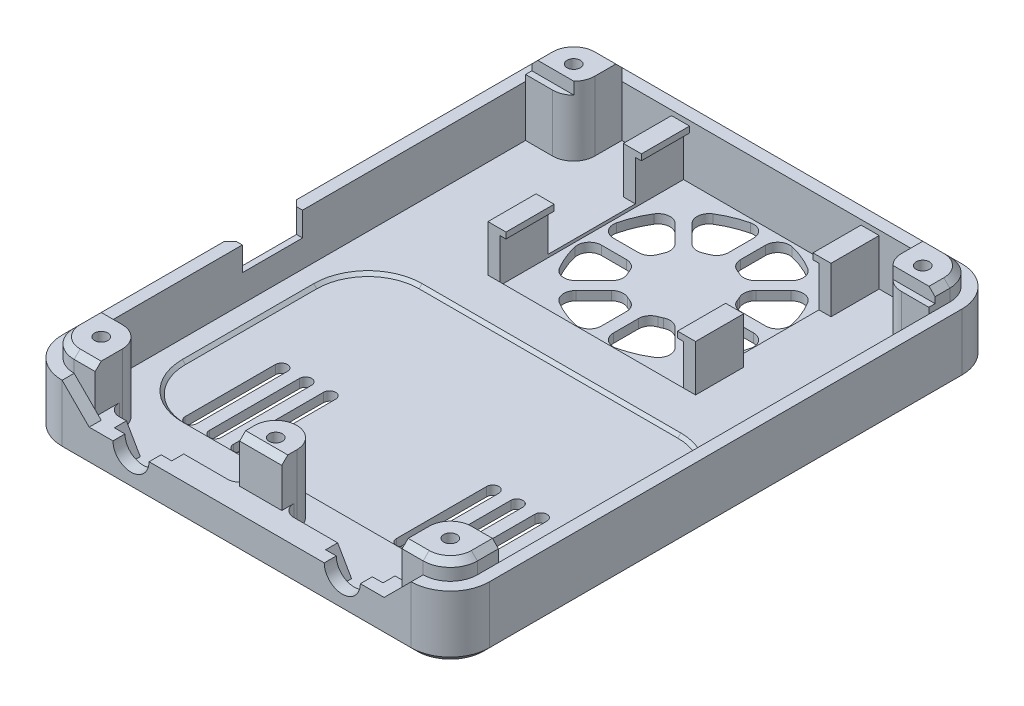
from build123d import *

# Parameters (mm, degrees)
BOSS_EXTRUDE1_DEPTH            = 10.5
BOSS_EXTRUDE2_DEPTH            = 2
BOSS_EXTRUDE4_DEPTH            = 11.5
BOSS_EXTRUDE6_REACH            = 65.208
CUT_EXTRUDE1_DEPTH             = 2
CUT_EXTRUDE2_REACH             = 89.912
SKETCH9_W                      = 10
SKETCH9_H                      = 4
CHAMFER1_SIZE                  = 1
CHAMFER2_SIZE                  = 1
BOSS_EXTRUDE7_DEPTH            = 2
SKETCH21_W                     = 67
SKETCH21_H                     = 1.043656047
CUT_EXTRUDE4_DEPTH             = 2
CUT_EXTRUDE5_DEPTH             = 0.5
CHAMFER4_SIZE                  = 1.5
CHAMFER5_SIZE                  = 1
CHAMFER6_SIZE                  = 1
CHAMFER7_SIZE                  = 1
F_2_2_2_2_DIAMETER_HOLE1_D     = 2.2
F_2_2_2_2_DIAMETER_HOLE1_DEPTH = 11.5
F_2_2_2_2_DIAMETER_HOLE1_TIP   = 0.660946681
SKETCH27_W                     = 7
SKETCH27_H                     = 2
CUT_EXTRUDE6_DEPTH             = 7.5
FILLET1_R                      = 2
CHAMFER8_SIZE                  = 1
CUT_EXTRUDE7_DEPTH             = 64.601942107
SKETCH29_W                     = 30.5
SKETCH29_H                     = 30.5
CUT_EXTRUDE8_DEPTH             = 0.5
SKETCH30_W                     = 2
SKETCH30_H                     = 8
BOSS_EXTRUDE8_DEPTH            = 7.7
SKETCH32_W                     = 1
SKETCH32_H                     = 8
BOSS_EXTRUDE10_DEPTH           = 1
CUT_EXTRUDE9_REACH             = 65.301


with BuildPart() as part:
    # Sketch2 → Boss-Extrude1 (new body)
    with BuildSketch(Plane(origin=(0, 0, 0), x_dir=(1, 0, 0), z_dir=(0, 1, 0))):
        with BuildLine():
            Line((-30.346153846, 41.446848386), (27.653846154, 41.446848386))
            ThreePointArc((27.653846154, 41.446848386), (32.250040232, 39.543042463), (34.153846154, 34.946848386))
            Line((34.153846154, 34.946848386), (34.153846154, -43.553151614))
            ThreePointArc((34.153846154, -43.553151614), (32.250040232, -48.149345692), (27.653846154, -50.053151614))
            Line((27.653846154, -50.053151614), (-30.346153846, -50.053151614))
            ThreePointArc((-30.346153846, -50.053151614), (-34.942347924, -48.149345692), (-36.846153846, -43.553151614))
            Line((-36.846153846, -43.553151614), (-36.846153846, 34.946848386))
            ThreePointArc((-36.846153846, 34.946848386), (-34.942347924, 39.543042463), (-30.346153846, 41.446848386))
        make_face()
        with BuildLine():
            Line((-30.346153846, 39.446848386), (27.653846154, 39.446848386))
            ThreePointArc((27.653846154, 39.446848386), (30.835826669, 38.128828901), (32.153846154, 34.946848386))
            Line((32.153846154, 34.946848386), (32.153846154, -43.553151614))
            ThreePointArc((32.153846154, -43.553151614), (30.835826669, -46.73513213), (27.653846154, -48.053151614))
            Line((27.653846154, -48.053151614), (-30.346153846, -48.053151614))
            ThreePointArc((-30.346153846, -48.053151614), (-33.528134361, -46.73513213), (-34.846153846, -43.553151614))
            Line((-34.846153846, -43.553151614), (-34.846153846, 34.946848386))
            ThreePointArc((-34.846153846, 34.946848386), (-33.528134361, 38.128828901), (-30.346153846, 39.446848386))
        make_face(mode=Mode.SUBTRACT)
    extrude(amount=BOSS_EXTRUDE1_DEPTH)

    # Sketch3 → Boss-Extrude2 (add)
    with BuildSketch(Plane(origin=(0, 0, 0), x_dir=(1, 0, 0), z_dir=(0, 1, 0))):
        with BuildLine():
            Line((-30.346153846, -48.053151614), (27.653846154, -48.053151614))
            ThreePointArc((27.653846154, -48.053151614), (30.835826669, -46.73513213), (32.153846154, -43.553151614))
            Line((32.153846154, -43.553151614), (32.153846154, 34.946848386))
            ThreePointArc((32.153846154, 34.946848386), (30.835826669, 38.128828901), (27.653846154, 39.446848386))
            Line((27.653846154, 39.446848386), (-30.346153846, 39.446848386))
            ThreePointArc((-30.346153846, 39.446848386), (-33.528134361, 38.128828901), (-34.846153846, 34.946848386))
            Line((-34.846153846, 34.946848386), (-34.846153846, -43.553151614))
            ThreePointArc((-34.846153846, -43.553151614), (-33.528134361, -46.73513213), (-30.346153846, -48.053151614))
        make_face()
    extrude(amount=BOSS_EXTRUDE2_DEPTH)

    # Sketch6 → Boss-Extrude4 (add)
    with BuildSketch(Plane(origin=(0, 2, 0), x_dir=(1, 0, 0), z_dir=(0, 1, 0))):
        with BuildLine():
            Line((-26.846153846, 34.946848386), (-26.846153846, 39.446848386))
            Line((-26.846153846, 39.446848386), (-30.346153846, 39.446848386))
            ThreePointArc((-30.346153846, 39.446848386), (-33.528134361, 38.128828901), (-34.846153846, 34.946848386))
            Line((-34.846153846, 34.946848386), (-34.846153846, 31.446848386))
            Line((-34.846153846, 31.446848386), (-30.346153846, 31.446848386))
            ThreePointArc((-30.346153846, 31.446848386), (-27.871280112, 32.471974652), (-26.846153846, 34.946848386))
        make_face()
        with BuildLine():
            Line((24.153846154, 34.946848386), (24.153846154, 39.446848386))
            Line((24.153846154, 39.446848386), (27.653846154, 39.446848386))
            ThreePointArc((27.653846154, 39.446848386), (30.835826669, 38.128828901), (32.153846154, 34.946848386))
            Line((32.153846154, 34.946848386), (32.153846154, 31.446848386))
            Line((32.153846154, 31.446848386), (27.653846154, 31.446848386))
            ThreePointArc((27.653846154, 31.446848386), (25.17897242, 32.471974652), (24.153846154, 34.946848386))
        make_face()
    extrude(amount=BOSS_EXTRUDE4_DEPTH)

    # Boss-Extrude6: up to this face of the body (flat: up to its plane)
    boss_extrude6_end = Plane(part.part.faces().sort_by_distance((-30.766287969, 13.5, -35.366982508))[0])
    # Sketch8 → Boss-Extrude6 (add, up to the picked face)
    with BuildSketch(Plane(origin=(0, 2, 0), x_dir=(1, 0, 0), z_dir=(0, 1, 0)), mode=Mode.PRIVATE) as boss_extrude6_sk1:
        with BuildLine():
            Line((-4.846153846, -43.553151614), (-4.846153846, -48.053151614))
            Line((-4.846153846, -48.053151614), (2.153846154, -48.053151614))
            Line((2.153846154, -48.053151614), (2.153846154, -43.553151614))
            ThreePointArc((2.153846154, -43.553151614), (-1.346153846, -40.053151614), (-4.846153846, -43.553151614))
        make_face()
    boss_extrude6_tool1 = split(extrude(boss_extrude6_sk1.sketch, amount=BOSS_EXTRUDE6_REACH, mode=Mode.PRIVATE), bisect_by=boss_extrude6_end, keep=Keep.BOTH, mode=Mode.PRIVATE)
    # Sketch8 → Boss-Extrude6 (add, up to the picked face)
    with BuildSketch(Plane(origin=(0, 2, 0), x_dir=(1, 0, 0), z_dir=(0, 1, 0)), mode=Mode.PRIVATE) as boss_extrude6_sk2:
        with BuildLine():
            Line((32.153846154, -40.053151614), (32.153846154, -43.553151614))
            ThreePointArc((32.153846154, -43.553151614), (30.835826669, -46.73513213), (27.653846154, -48.053151614))
            Line((27.653846154, -48.053151614), (24.153846154, -48.053151614))
            Line((24.153846154, -48.053151614), (24.153846154, -43.553151614))
            ThreePointArc((24.153846154, -43.553151614), (25.17897242, -41.07827788), (27.653846154, -40.053151614))
            Line((27.653846154, -40.053151614), (32.153846154, -40.053151614))
        make_face()
    boss_extrude6_tool2 = split(extrude(boss_extrude6_sk2.sketch, amount=BOSS_EXTRUDE6_REACH, mode=Mode.PRIVATE), bisect_by=boss_extrude6_end, keep=Keep.BOTH, mode=Mode.PRIVATE)
    # Sketch8 → Boss-Extrude6 (add, up to the picked face)
    with BuildSketch(Plane(origin=(0, 2, 0), x_dir=(1, 0, 0), z_dir=(0, 1, 0)), mode=Mode.PRIVATE) as boss_extrude6_sk3:
        with BuildLine():
            Line((-34.846153846, -40.053151614), (-34.846153846, -43.553151614))
            ThreePointArc((-34.846153846, -43.553151614), (-33.528134361, -46.73513213), (-30.346153846, -48.053151614))
            Line((-30.346153846, -48.053151614), (-26.846153846, -48.053151614))
            Line((-26.846153846, -48.053151614), (-26.846153846, -43.553151614))
            ThreePointArc((-26.846153846, -43.553151614), (-27.871280112, -41.07827788), (-30.346153846, -40.053151614))
            Line((-30.346153846, -40.053151614), (-34.846153846, -40.053151614))
        make_face()
    boss_extrude6_tool3 = split(extrude(boss_extrude6_sk3.sketch, amount=BOSS_EXTRUDE6_REACH, mode=Mode.PRIVATE), bisect_by=boss_extrude6_end, keep=Keep.BOTH, mode=Mode.PRIVATE)
    add(boss_extrude6_tool1.solids().sort_by(Axis((-1.346154, 2, 44.386612), (0, 1, 0)))[0])
    add(boss_extrude6_tool2.solids().sort_by(Axis((28.07398, 2, 43.973286), (0, 1, 0)))[0])
    add(boss_extrude6_tool3.solids().sort_by(Axis((-30.766288, 2, 43.973286), (0, 1, 0)))[0])

    # Sketch7 → Cut-Extrude1 (cut)
    with BuildSketch(Plane.XY.offset(50.053151614)):
        with BuildLine():
            Line((27.653846154, 10.5), (-30.346153846, 10.5))
            Line((-30.346153846, 10.5), (-25.846153846, 6))
            Line((-25.846153846, 6), (-21.89693017, 6))
            ThreePointArc((-21.89693017, 6), (-18.89693017, 3), (-15.89693017, 6))
            Line((-15.89693017, 6), (13.204622477, 6))
            ThreePointArc((13.204622477, 6), (16.204622477, 3), (19.204622477, 6))
            Line((19.204622477, 6), (23.153846154, 6))
            Line((23.153846154, 6), (27.653846154, 10.5))
        make_face()
    extrude(amount=-CUT_EXTRUDE1_DEPTH, mode=Mode.SUBTRACT)

    # Sketch9 → Cut-Extrude2 (cut, up to next)
    with BuildSketch(Plane.ZY.offset(36.846153846), mode=Mode.PRIVATE) as cut_extrude2_sk1:
        with Locations((10.611298715, 8.5)):
            Rectangle(SKETCH9_W, SKETCH9_H)
    cut_extrude2_tool1 = extrude(cut_extrude2_sk1.sketch, amount=-CUT_EXTRUDE2_REACH, mode=Mode.PRIVATE) & part.part
    add(cut_extrude2_tool1.solids().sort_by_distance((-36.846154, 8.5, 10.611299))[0], mode=Mode.SUBTRACT)

    # Chamfer1
    chamfer1_edges = [part.edges().sort_by_distance(p)[0] for p in [
        (-36.846153846, 8.5, 5.611298715),
        (-36.846153846, 6.5, 10.611298715),
        (-36.846153846, 8.5, 15.611298715),
    ]]
    chamfer(chamfer1_edges, length=CHAMFER1_SIZE)

    # Chamfer2
    chamfer2_edges = [part.edges().sort_by_distance(p)[0] for p in [
        (-36.846153846, 0, 4.303151614),
        (-34.942347924, 0, -39.543042463),
        (-1.346153846, 0, -41.446848386),
        (32.250040232, 0, -39.543042463),
        (34.153846154, 0, 4.303151614),
        (32.250040232, 0, 48.149345692),
        (-1.346153846, 0, 50.053151614),
        (-34.942347924, 0, 48.149345692),
    ]]
    chamfer(chamfer2_edges, length=CHAMFER2_SIZE)

    # Sketch19 → Boss-Extrude7 (add)
    with BuildSketch(Plane(origin=(0, 0, 48.053151614), x_dir=(-1, 0, 0), z_dir=(0, 0, -1))):
        Polygon((26.846153846, 6), (23.660734993, 6), (21.351333916, 2), (26.846153846, 2), align=None)
        Polygon((4.846153846, 2), (16.442526423, 2), (14.133125347, 6), (4.846153846, 6), align=None)
        Polygon((-13.750218731, 2), (-2.153846154, 2), (-2.153846154, 6), (-11.440817654, 6), align=None)
        Polygon((-24.153846154, 2), (-18.659026224, 2), (-20.968427301, 6), (-24.153846154, 6), align=None)
    extrude(amount=BOSS_EXTRUDE7_DEPTH)

    # Sketch21 → Cut-Extrude4 (cut)
    with BuildSketch(Plane(origin=(0, 13.5, 0), x_dir=(1, 0, 0), z_dir=(0, 1, 0))):
        with Locations((-1.346153846, 31.96867641)):
            Rectangle(SKETCH21_W, SKETCH21_H)
    extrude(amount=-CUT_EXTRUDE4_DEPTH, mode=Mode.SUBTRACT)

    # Sketch22 → Cut-Extrude5 (cut)
    with BuildSketch(Plane(origin=(0, 2, 0), x_dir=(1, 0, 0), z_dir=(0, 1, 0))):
        with BuildLine():
            Line((-22.846153846, 3.259423313), (20.153846154, 3.259423313))
            ThreePointArc((20.153846154, 3.259423313), (27.224913966, 0.330491125), (30.153846154, -6.740576687))
            Line((30.153846154, -6.740576687), (30.153846154, -28.568151594))
            ThreePointArc((30.153846154, -28.568151594), (27.224913966, -35.639219406), (20.153846154, -38.568151594))
            Line((20.153846154, -38.568151594), (-22.846153846, -38.568151594))
            ThreePointArc((-22.846153846, -38.568151594), (-29.917221658, -35.639219406), (-32.846153846, -28.568151594))
            Line((-32.846153846, -28.568151594), (-32.846153846, -6.740576687))
            ThreePointArc((-32.846153846, -6.740576687), (-29.917221658, 0.330491125), (-22.846153846, 3.259423313))
        make_face()
    extrude(amount=-CUT_EXTRUDE5_DEPTH, mode=Mode.SUBTRACT)

    # Chamfer4
    # the kernel refuses this chamfer: 1.5 mm, written as the material it adds along each edge
    with BuildSketch(Plane(origin=(20.153846154, 1.5, 38.568151594), x_dir=(0, 0.9996219169112968, 0.027495876610586775), z_dir=(-1, 0, 0))) as chamfer4_piece_1_section:
        Polygon((CHAMFER4_SIZE * 0.999621916911, CHAMFER4_SIZE * 0.0274958766106), (-CHAMFER4_SIZE * 0.0274958766106, CHAMFER4_SIZE * 0.999621916911), (0, 0), align=None)
    chamfer4_piece_1 = extrude(amount=43, mode=Mode.PRIVATE)
    chamfer4_piece_1 = split(chamfer4_piece_1, bisect_by=Plane(origin=(-1.346153846, 2, 37.925091261), z_dir=(0, -1, 0)), keep=Keep.TOP, mode=Mode.PRIVATE)
    add(chamfer4_piece_1)
    with BuildSketch(Plane(origin=(20.153846154, 1.5, 28.568151594), x_dir=(1, 0, 0), z_dir=(0, 0, -1))) as chamfer4_piece_2_section:
        Polygon((10, -CHAMFER4_SIZE), (10 - CHAMFER4_SIZE, 0), (10, 0), align=None)
    chamfer4_piece_2 = revolve(axis=Axis((20.153846154, 1.5, 28.568151594), (0, -1, 0)), revolution_arc=90, mode=Mode.PRIVATE)
    chamfer4_piece_2 = split(chamfer4_piece_2, bisect_by=Plane(origin=(26.336878158, 2, 34.751183598), z_dir=(0, -1, 0)), keep=Keep.TOP, mode=Mode.PRIVATE)
    add(chamfer4_piece_2)
    with BuildSketch(Plane(origin=(-22.846153846, 1.5, 28.568151594), x_dir=(0, 0, 1), z_dir=(1, 0, 0))) as chamfer4_piece_3_section:
        Polygon((10, -CHAMFER4_SIZE), (10 - CHAMFER4_SIZE, 0), (10, 0), align=None)
    chamfer4_piece_3 = revolve(axis=Axis((-22.846153846, 1.5, 28.568151594), (0, -1, 0)), revolution_arc=90, mode=Mode.PRIVATE)
    chamfer4_piece_3 = split(chamfer4_piece_3, bisect_by=Plane(origin=(-29.02918585, 2, 34.751183598), z_dir=(0, -1, 0)), keep=Keep.TOP, mode=Mode.PRIVATE)
    add(chamfer4_piece_3)
    with BuildSketch(Plane(origin=(30.153846154, 1.5, 6.740576687), x_dir=(0.027495876610586775, 0.9996219169112968, 0), z_dir=(0, 0, 1))) as chamfer4_piece_4_section:
        Polygon((CHAMFER4_SIZE * 0.999621916911, CHAMFER4_SIZE * 0.0274958766106), (-CHAMFER4_SIZE * 0.0274958766106, CHAMFER4_SIZE * 0.999621916911), (0, 0), align=None)
    chamfer4_piece_4 = extrude(amount=21.827574907, mode=Mode.PRIVATE)
    chamfer4_piece_4 = split(chamfer4_piece_4, bisect_by=Plane(origin=(29.51078582, 2, 17.654364141), z_dir=(0, -1, 0)), keep=Keep.TOP, mode=Mode.PRIVATE)
    add(chamfer4_piece_4)
    with BuildSketch(Plane(origin=(-32.846153846, 1.5, 28.568151594), x_dir=(-0.027495876610586775, 0.9996219169112968, 0), z_dir=(0, 0, -1))) as chamfer4_piece_5_section:
        Polygon((CHAMFER4_SIZE * 0.999621916911, CHAMFER4_SIZE * 0.0274958766106), (-CHAMFER4_SIZE * 0.0274958766106, CHAMFER4_SIZE * 0.999621916911), (0, 0), align=None)
    chamfer4_piece_5 = extrude(amount=21.827574907, mode=Mode.PRIVATE)
    chamfer4_piece_5 = split(chamfer4_piece_5, bisect_by=Plane(origin=(-32.203093513, 2, 17.654364141), z_dir=(0, -1, 0)), keep=Keep.TOP, mode=Mode.PRIVATE)
    add(chamfer4_piece_5)
    with BuildSketch(Plane(origin=(20.153846154, 1.5, 6.740576687), x_dir=(0, 0, -1), z_dir=(-1, 0, 0))) as chamfer4_piece_6_section:
        Polygon((10, -CHAMFER4_SIZE), (10 - CHAMFER4_SIZE, 0), (10, 0), align=None)
    chamfer4_piece_6 = revolve(axis=Axis((20.153846154, 1.5, 6.740576687), (0, -1, 0)), revolution_arc=90, mode=Mode.PRIVATE)
    chamfer4_piece_6 = split(chamfer4_piece_6, bisect_by=Plane(origin=(26.336878158, 2, 0.557544683), z_dir=(0, -1, 0)), keep=Keep.TOP, mode=Mode.PRIVATE)
    add(chamfer4_piece_6)
    with BuildSketch(Plane(origin=(-22.846153846, 1.5, 6.740576687), x_dir=(-1, 0, 0), z_dir=(0, 0, 1))) as chamfer4_piece_7_section:
        Polygon((10, -CHAMFER4_SIZE), (10 - CHAMFER4_SIZE, 0), (10, 0), align=None)
    chamfer4_piece_7 = revolve(axis=Axis((-22.846153846, 1.5, 6.740576687), (0, -1, 0)), revolution_arc=90, mode=Mode.PRIVATE)
    chamfer4_piece_7 = split(chamfer4_piece_7, bisect_by=Plane(origin=(-29.02918585, 2, 0.557544683), z_dir=(0, -1, 0)), keep=Keep.TOP, mode=Mode.PRIVATE)
    add(chamfer4_piece_7)
    with BuildSketch(Plane(origin=(-22.846153846, 1.5, -3.259423313), x_dir=(0, 0.9996219169112969, -0.02749587661058649), z_dir=(1, 0, 0))) as chamfer4_piece_8_section:
        Polygon((CHAMFER4_SIZE * 0.999621916911, CHAMFER4_SIZE * 0.0274958766106), (-CHAMFER4_SIZE * 0.0274958766106, CHAMFER4_SIZE * 0.999621916911), (0, 0), align=None)
    chamfer4_piece_8 = extrude(amount=43, mode=Mode.PRIVATE)
    chamfer4_piece_8 = split(chamfer4_piece_8, bisect_by=Plane(origin=(-1.346153846, 2, -2.616362979), z_dir=(0, -1, 0)), keep=Keep.TOP, mode=Mode.PRIVATE)
    add(chamfer4_piece_8)

    # Chamfer5
    chamfer5_edges = [part.edges().sort_by_distance(p)[0] for p in [
        (32.153846154, 13.5, -33.718676409),
        (30.835826669, 13.5, -38.128828901),
        (25.903846154, 13.5, -39.446848386),
    ]]
    chamfer(chamfer5_edges, length=CHAMFER5_SIZE)

    # Chamfer6
    chamfer6_edges = [part.edges().sort_by_distance(p)[0] for p in [
        (-28.596153846, 13.5, -39.446848386),
        (-33.528134361, 13.5, -38.128828901),
        (-34.846153846, 13.5, -33.718676409),
    ]]
    chamfer(chamfer6_edges, length=CHAMFER6_SIZE)

    # Chamfer7
    chamfer7_edges = [part.edges().sort_by_distance(p)[0] for p in [
        (25.903846154, 13.5, 48.053151614),
        (30.835826669, 13.5, 46.73513213),
        (32.153846154, 13.5, 41.803151614),
        (-34.846153846, 13.5, 41.803151614),
        (-33.528134361, 13.5, 46.73513213),
        (-28.596153846, 13.5, 48.053151614),
    ]]
    chamfer(chamfer7_edges, length=CHAMFER7_SIZE)

    # Ø2.2 (2.2) Diameter Hole1
    with Locations(Plane(origin=(0, 13.5, 0), x_dir=(1, 0, 0), z_dir=(0, 1, 0))):
        with Locations((-30.346153846, -43.553151614), (27.653846154, -43.553151614), (27.653846154, 34.946848386), (-30.346153846, 34.946848386), (-1.346153846, -43.553151614)):
            Hole(F_2_2_2_2_DIAMETER_HOLE1_D / 2, depth=F_2_2_2_2_DIAMETER_HOLE1_DEPTH)
            with Locations((0, 0, -(F_2_2_2_2_DIAMETER_HOLE1_DEPTH + F_2_2_2_2_DIAMETER_HOLE1_TIP / 2))):  # 118° drill point
                Cone(0, F_2_2_2_2_DIAMETER_HOLE1_D / 2, F_2_2_2_2_DIAMETER_HOLE1_TIP, mode=Mode.SUBTRACT)

    # Sketch27 → Cut-Extrude6 (cut)
    with BuildSketch(Plane(origin=(0, 13.5, 0), x_dir=(1, 0, 0), z_dir=(0, 1, 0))):
        with Locations((-1.346153846, -47.053151614)):
            Rectangle(SKETCH27_W, SKETCH27_H)
    extrude(amount=-CUT_EXTRUDE6_DEPTH, mode=Mode.SUBTRACT)

    # Fillet1
    fillet1_edges = [part.edges().sort_by_distance(p)[0] for p in [
        (24.153846154, 4, 46.053151614),
        (-26.846153846, 4, 46.053151614),
        (2.153846154, 4, 46.053151614),
        (-4.846153846, 4, 46.053151614),
    ]]
    fillet(fillet1_edges, radius=FILLET1_R)

    # Chamfer8
    chamfer8_edges = [part.edges().sort_by_distance(p)[0] for p in [
        (-1.346153846, 13.5, 46.053151614),
    ]]
    chamfer(chamfer8_edges, length=CHAMFER8_SIZE)

    # Sketch28 → Cut-Extrude7 (cut, through all)
    with BuildSketch(Plane.XZ):
        with BuildLine():
            Line((-17.89693017, 36.053151614), (-17.89693017, 21.053151614))
            ThreePointArc((-17.89693017, 21.053151614), (-18.89693017, 20.053151614), (-19.89693017, 21.053151614))
            Line((-19.89693017, 21.053151614), (-19.89693017, 36.053151614))
            ThreePointArc((-19.89693017, 36.053151614), (-18.89693017, 37.053151614), (-17.89693017, 36.053151614))
        make_face()
        with BuildLine():
            Line((-21.89693017, 36.053151614), (-21.89693017, 21.053151614))
            ThreePointArc((-21.89693017, 21.053151614), (-22.89693017, 20.053151614), (-23.89693017, 21.053151614))
            Line((-23.89693017, 21.053151614), (-23.89693017, 36.053151614))
            ThreePointArc((-23.89693017, 36.053151614), (-22.89693017, 37.053151614), (-21.89693017, 36.053151614))
        make_face()
        with BuildLine():
            Line((-13.89693017, 36.053151614), (-13.89693017, 21.053151614))
            ThreePointArc((-13.89693017, 21.053151614), (-14.89693017, 20.053151614), (-15.89693017, 21.053151614))
            Line((-15.89693017, 21.053151614), (-15.89693017, 36.053151614))
            ThreePointArc((-15.89693017, 36.053151614), (-14.89693017, 37.053151614), (-13.89693017, 36.053151614))
        make_face()
        with BuildLine():
            Line((17.204622477, 36.053151614), (17.204622477, 21.053151614))
            ThreePointArc((17.204622477, 21.053151614), (16.204622477, 20.053151614), (15.204622477, 21.053151614))
            Line((15.204622477, 21.053151614), (15.204622477, 36.053151614))
            ThreePointArc((15.204622477, 36.053151614), (16.204622477, 37.053151614), (17.204622477, 36.053151614))
        make_face()
        with BuildLine():
            Line((13.204622477, 36.053151614), (13.204622477, 21.053151614))
            ThreePointArc((13.204622477, 21.053151614), (12.204622477, 20.053151614), (11.204622477, 21.053151614))
            Line((11.204622477, 21.053151614), (11.204622477, 36.053151614))
            ThreePointArc((11.204622477, 36.053151614), (12.204622477, 37.053151614), (13.204622477, 36.053151614))
        make_face()
        with BuildLine():
            Line((21.204622477, 36.053151614), (21.204622477, 21.053151614))
            ThreePointArc((21.204622477, 21.053151614), (20.204622477, 20.053151614), (19.204622477, 21.053151614))
            Line((19.204622477, 21.053151614), (19.204622477, 36.053151614))
            ThreePointArc((19.204622477, 36.053151614), (20.204622477, 37.053151614), (21.204622477, 36.053151614))
        make_face()
    extrude(amount=-CUT_EXTRUDE7_DEPTH, mode=Mode.SUBTRACT)

    # Sketch29 → Cut-Extrude8 (cut)
    with BuildSketch(Plane(origin=(0, 2, 0), x_dir=(1, 0, 0), z_dir=(0, 1, 0))):
        with Locations((-1.346153846, 24.196848386)):
            Rectangle(SKETCH29_W, SKETCH29_H)
    extrude(amount=-CUT_EXTRUDE8_DEPTH, mode=Mode.SUBTRACT)

    # Sketch30 → Boss-Extrude8 (add)
    with BuildSketch(Plane(origin=(0, 2, 0), x_dir=(1, 0, 0), z_dir=(0, 1, 0))):
        with Locations((14.903846154, 35.446848386)):
            Rectangle(SKETCH30_W, SKETCH30_H)
        with Locations((-17.596153846, 35.446848386)):
            Rectangle(SKETCH30_W, SKETCH30_H)
        with Locations((-17.596153846, 12.946848386)):
            Rectangle(SKETCH30_W, SKETCH30_H)
        with Locations((14.903846154, 12.946848386)):
            Rectangle(SKETCH30_W, SKETCH30_H)
    extrude(amount=BOSS_EXTRUDE8_DEPTH)

    # Sketch32 → Boss-Extrude10 (add)
    with BuildSketch(Plane(origin=(0, 9.7, 0), x_dir=(1, 0, 0), z_dir=(0, 1, 0))):
        with Locations((13.403846154, 35.446848386)):
            Rectangle(SKETCH32_W, SKETCH32_H)
        with Locations((-16.096153846, 35.446848386)):
            Rectangle(SKETCH32_W, SKETCH32_H)
        with Locations((-16.096153846, 12.946848386)):
            Rectangle(SKETCH32_W, SKETCH32_H)
        with Locations((13.403846154, 12.946848386)):
            Rectangle(SKETCH32_W, SKETCH32_H)
    extrude(amount=-BOSS_EXTRUDE10_DEPTH)

    # Sketch33 → Cut-Extrude9 (cut, up to next)
    with BuildSketch(Plane(origin=(0, 1.5, 0), x_dir=(1, 0, 0), z_dir=(0, 1, 0)), mode=Mode.PRIVATE) as cut_extrude9_sk1:
        with BuildLine():
            ThreePointArc((-14.114144908, 32.069484808), (-12.644088473, 33.006258364), (-10.997532537, 32.434013514))
            Line((-10.997532537, 32.434013514), (-8.053260627, 29.489741604))
            ThreePointArc((-8.053260627, 29.489741604), (-7.49627707, 28.413732), (-7.662736336, 27.21359923))
            ThreePointArc((-7.662736336, 27.21359923), (-7.813310574, 26.875632412), (-7.945817137, 26.530181719))
            ThreePointArc((-7.945817137, 26.530181719), (-8.676734682, 25.563855224), (-9.83143522, 25.196848386))
            Line((-9.83143522, 25.196848386), (-13.995264487, 25.196848386))
            ThreePointArc((-13.995264487, 25.196848386), (-15.564193568, 25.95650104), (-15.941281508, 27.658386847))
            ThreePointArc((-15.941281508, 27.658386847), (-15.204346834, 29.937099871), (-14.114144908, 32.069484808))
        make_face()
    cut_extrude9_tool1 = extrude(cut_extrude9_sk1.sketch, amount=-CUT_EXTRUDE9_REACH, mode=Mode.PRIVATE) & part.part
    # Sketch33 → Cut-Extrude9 (cut, up to next)
    with BuildSketch(Plane(origin=(0, 1.5, 0), x_dir=(1, 0, 0), z_dir=(0, 1, 0)), mode=Mode.PRIVATE) as cut_extrude9_sk2:
        with BuildLine():
            ThreePointArc((-9.583318975, 33.848227077), (-10.155563824, 35.494783012), (-9.218790269, 36.964839447))
            ThreePointArc((-9.218790269, 36.964839447), (-7.086405332, 38.055041373), (-4.807692308, 38.791976048))
            ThreePointArc((-4.807692308, 38.791976048), (-3.1058065, 38.414888107), (-2.346153846, 36.845959026))
            Line((-2.346153846, 36.845959026), (-2.346153846, 32.68212976))
            ThreePointArc((-2.346153846, 32.68212976), (-2.713160684, 31.527429222), (-3.679487179, 30.796511677))
            ThreePointArc((-3.679487179, 30.796511677), (-4.024937873, 30.664005113), (-4.36290469, 30.513430875))
            ThreePointArc((-4.36290469, 30.513430875), (-5.56303746, 30.34697161), (-6.639047065, 30.903955167))
            Line((-6.639047065, 30.903955167), (-9.583318975, 33.848227077))
        make_face()
    cut_extrude9_tool2 = extrude(cut_extrude9_sk2.sketch, amount=-CUT_EXTRUDE9_REACH, mode=Mode.PRIVATE) & part.part
    # Sketch33 → Cut-Extrude9 (cut, up to next)
    with BuildSketch(Plane(origin=(0, 1.5, 0), x_dir=(1, 0, 0), z_dir=(0, 1, 0)), mode=Mode.PRIVATE) as cut_extrude9_sk3:
        with BuildLine():
            ThreePointArc((-0.346153846, 36.845959026), (0.413498808, 38.414888107), (2.115384615, 38.791976048))
            ThreePointArc((2.115384615, 38.791976048), (4.394097639, 38.055041373), (6.526482577, 36.964839447))
            ThreePointArc((6.526482577, 36.964839447), (7.463256132, 35.494783012), (6.891011283, 33.848227077))
            Line((6.891011283, 33.848227077), (3.946739373, 30.903955167))
            ThreePointArc((3.946739373, 30.903955167), (2.870729768, 30.34697161), (1.670596998, 30.513430875))
            ThreePointArc((1.670596998, 30.513430875), (1.33263018, 30.664005113), (0.987179487, 30.796511677))
            ThreePointArc((0.987179487, 30.796511677), (0.020852992, 31.527429222), (-0.346153846, 32.68212976))
            Line((-0.346153846, 32.68212976), (-0.346153846, 36.845959026))
        make_face()
    cut_extrude9_tool3 = extrude(cut_extrude9_sk3.sketch, amount=-CUT_EXTRUDE9_REACH, mode=Mode.PRIVATE) & part.part
    # Sketch33 → Cut-Extrude9 (cut, up to next)
    with BuildSketch(Plane(origin=(0, 1.5, 0), x_dir=(1, 0, 0), z_dir=(0, 1, 0)), mode=Mode.PRIVATE) as cut_extrude9_sk4:
        with BuildLine():
            ThreePointArc((13.248973816, 27.658386847), (12.871885876, 25.95650104), (11.302956795, 25.196848386))
            Line((11.302956795, 25.196848386), (7.139127528, 25.196848386))
            ThreePointArc((7.139127528, 25.196848386), (5.98442699, 25.563855224), (5.253509445, 26.530181719))
            ThreePointArc((5.253509445, 26.530181719), (5.121002881, 26.875632412), (4.970428643, 27.21359923))
            ThreePointArc((4.970428643, 27.21359923), (4.803969378, 28.413732), (5.360952935, 29.489741604))
            Line((5.360952935, 29.489741604), (8.305224845, 32.434013514))
            ThreePointArc((8.305224845, 32.434013514), (9.951780781, 33.006258364), (11.421837216, 32.069484808))
            ThreePointArc((11.421837216, 32.069484808), (12.512039142, 29.937099871), (13.248973816, 27.658386847))
        make_face()
    cut_extrude9_tool4 = extrude(cut_extrude9_sk4.sketch, amount=-CUT_EXTRUDE9_REACH, mode=Mode.PRIVATE) & part.part
    # Sketch33 → Cut-Extrude9 (cut, up to next)
    with BuildSketch(Plane(origin=(0, 1.5, 0), x_dir=(1, 0, 0), z_dir=(0, 1, 0)), mode=Mode.PRIVATE) as cut_extrude9_sk5:
        with BuildLine():
            ThreePointArc((11.421837216, 16.324211963), (9.951780781, 15.387438407), (8.305224845, 15.959683257))
            Line((8.305224845, 15.959683257), (5.360952935, 18.903955167))
            ThreePointArc((5.360952935, 18.903955167), (4.803969378, 19.979964772), (4.970428643, 21.180097542))
            ThreePointArc((4.970428643, 21.180097542), (5.121002881, 21.518064359), (5.253509445, 21.863515052))
            ThreePointArc((5.253509445, 21.863515052), (5.98442699, 22.829841548), (7.139127528, 23.196848386))
            Line((7.139127528, 23.196848386), (11.302956795, 23.196848386))
            ThreePointArc((11.302956795, 23.196848386), (12.871885876, 22.437195732), (13.248973816, 20.735309924))
            ThreePointArc((13.248973816, 20.735309924), (12.512039142, 18.4565969), (11.421837216, 16.324211963))
        make_face()
    cut_extrude9_tool5 = extrude(cut_extrude9_sk5.sketch, amount=-CUT_EXTRUDE9_REACH, mode=Mode.PRIVATE) & part.part
    # Sketch33 → Cut-Extrude9 (cut, up to next)
    with BuildSketch(Plane(origin=(0, 1.5, 0), x_dir=(1, 0, 0), z_dir=(0, 1, 0)), mode=Mode.PRIVATE) as cut_extrude9_sk6:
        with BuildLine():
            ThreePointArc((2.115384615, 9.601720723), (0.413498808, 9.978808664), (-0.346153846, 11.547737745))
            Line((-0.346153846, 11.547737745), (-0.346153846, 15.711567011))
            ThreePointArc((-0.346153846, 15.711567011), (0.020852992, 16.86626755), (0.987179487, 17.597185095))
            ThreePointArc((0.987179487, 17.597185095), (1.33263018, 17.729691658), (1.670596998, 17.880265896))
            ThreePointArc((1.670596998, 17.880265896), (2.870729768, 18.046725161), (3.946739373, 17.489741604))
            Line((3.946739373, 17.489741604), (6.891011283, 14.545469694))
            ThreePointArc((6.891011283, 14.545469694), (7.463256132, 12.898913759), (6.526482577, 11.428857324))
            ThreePointArc((6.526482577, 11.428857324), (4.394097639, 10.338655398), (2.115384615, 9.601720723))
        make_face()
    cut_extrude9_tool6 = extrude(cut_extrude9_sk6.sketch, amount=-CUT_EXTRUDE9_REACH, mode=Mode.PRIVATE) & part.part
    # Sketch33 → Cut-Extrude9 (cut, up to next)
    with BuildSketch(Plane(origin=(0, 1.5, 0), x_dir=(1, 0, 0), z_dir=(0, 1, 0)), mode=Mode.PRIVATE) as cut_extrude9_sk7:
        with BuildLine():
            ThreePointArc((-9.218790269, 11.428857324), (-10.155563824, 12.898913759), (-9.583318975, 14.545469694))
            Line((-9.583318975, 14.545469694), (-6.639047065, 17.489741604))
            ThreePointArc((-6.639047065, 17.489741604), (-5.56303746, 18.046725161), (-4.36290469, 17.880265896))
            ThreePointArc((-4.36290469, 17.880265896), (-4.024937873, 17.729691658), (-3.679487179, 17.597185095))
            ThreePointArc((-3.679487179, 17.597185095), (-2.713160684, 16.86626755), (-2.346153846, 15.711567011))
            Line((-2.346153846, 15.711567011), (-2.346153846, 11.547737745))
            ThreePointArc((-2.346153846, 11.547737745), (-3.1058065, 9.978808664), (-4.807692308, 9.601720723))
            ThreePointArc((-4.807692308, 9.601720723), (-7.086405332, 10.338655398), (-9.218790269, 11.428857324))
        make_face()
    cut_extrude9_tool7 = extrude(cut_extrude9_sk7.sketch, amount=-CUT_EXTRUDE9_REACH, mode=Mode.PRIVATE) & part.part
    # Sketch33 → Cut-Extrude9 (cut, up to next)
    with BuildSketch(Plane(origin=(0, 1.5, 0), x_dir=(1, 0, 0), z_dir=(0, 1, 0)), mode=Mode.PRIVATE) as cut_extrude9_sk8:
        with BuildLine():
            ThreePointArc((-15.941281508, 20.735309924), (-15.564193568, 22.437195732), (-13.995264487, 23.196848386))
            Line((-13.995264487, 23.196848386), (-9.83143522, 23.196848386))
            ThreePointArc((-9.83143522, 23.196848386), (-8.676734682, 22.829841548), (-7.945817137, 21.863515052))
            ThreePointArc((-7.945817137, 21.863515052), (-7.813310574, 21.518064359), (-7.662736336, 21.180097542))
            ThreePointArc((-7.662736336, 21.180097542), (-7.49627707, 19.979964772), (-8.053260627, 18.903955167))
            Line((-8.053260627, 18.903955167), (-10.997532537, 15.959683257))
            ThreePointArc((-10.997532537, 15.959683257), (-12.644088473, 15.387438407), (-14.114144908, 16.324211963))
            ThreePointArc((-14.114144908, 16.324211963), (-15.204346834, 18.4565969), (-15.941281508, 20.735309924))
        make_face()
    cut_extrude9_tool8 = extrude(cut_extrude9_sk8.sketch, amount=-CUT_EXTRUDE9_REACH, mode=Mode.PRIVATE) & part.part
    add(cut_extrude9_tool1.solids().sort_by_distance((-11.877071, 1.5, -28.558897))[0], mode=Mode.SUBTRACT)
    add(cut_extrude9_tool2.solids().sort_by_distance((-5.708203, 1.5, -34.727766))[0], mode=Mode.SUBTRACT)
    add(cut_extrude9_tool3.solids().sort_by_distance((3.015895, 1.5, -34.727766))[0], mode=Mode.SUBTRACT)
    add(cut_extrude9_tool4.solids().sort_by_distance((9.184764, 1.5, -28.558897))[0], mode=Mode.SUBTRACT)
    add(cut_extrude9_tool5.solids().sort_by_distance((9.184764, 1.5, -19.8348))[0], mode=Mode.SUBTRACT)
    add(cut_extrude9_tool6.solids().sort_by_distance((3.015895, 1.5, -13.665931))[0], mode=Mode.SUBTRACT)
    add(cut_extrude9_tool7.solids().sort_by_distance((-5.708203, 1.5, -13.665931))[0], mode=Mode.SUBTRACT)
    add(cut_extrude9_tool8.solids().sort_by_distance((-11.877071, 1.5, -19.8348))[0], mode=Mode.SUBTRACT)


solid = part.part
